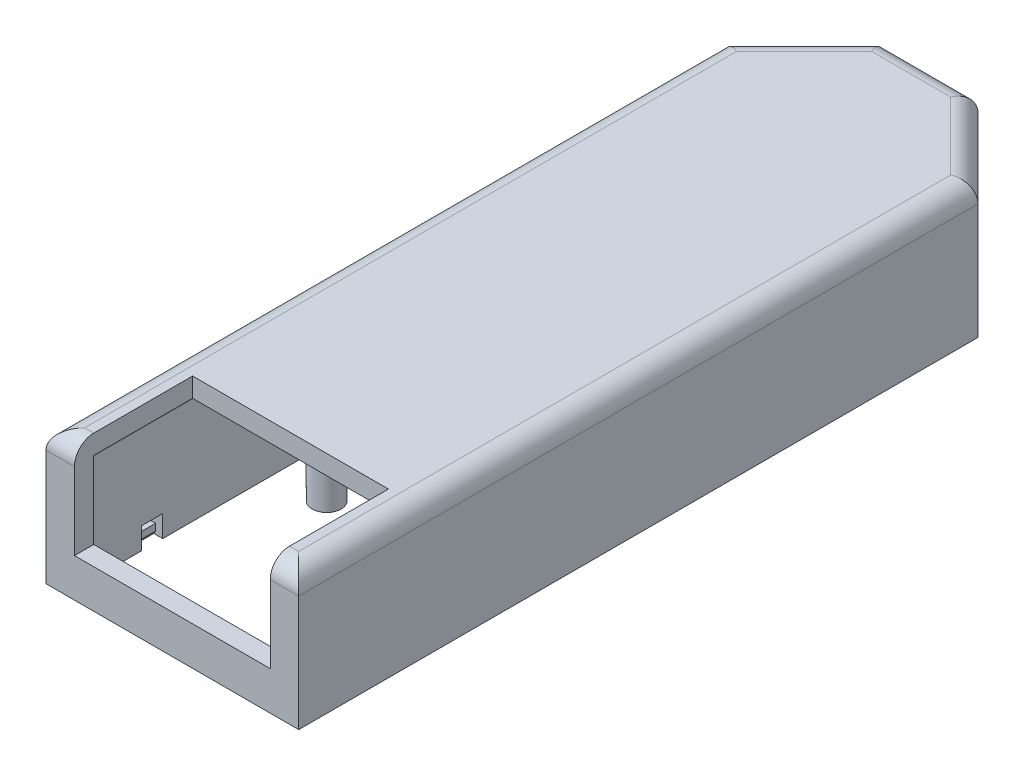
from build123d import *

# Parameters (mm, degrees)
BOSS_EXTRUDE1_DEPTH       = 14
CUT_EXTRUDE1_DEPTH        = 12
SKETCH3_W                 = 1.75
SKETCH3_H                 = 2.2
CUT_EXTRUDE2_DEPTH        = 2.25
SKETCH5_W                 = 2.2
SKETCH5_H                 = 1.25
CUT_EXTRUDE3_DEPTH        = 0.8
CHAMFER1_SIZE             = 0.3
CHAMFER1_SIZE2            = 0.173205081
CHAMFER1_OF_MIRROR1_SIZE2 = 0.3
CHAMFER1_OF_MIRROR1_SIZE  = 0.173205081
LPATTERN1_START           = -36.6
LPATTERN1_DEPTH           = 2.2
LPATTERN1_START_2         = -8.1
LPATTERN1_2_DEPTH         = 2.2
SKETCH7_W                 = 3
SKETCH7_H                 = 1.75
CUT_EXTRUDE4_DEPTH        = 2.25
CHAMFER2_SIZE             = 0.3
CHAMFER2_SIZE2            = 0.519615242
SKETCH8_W                 = 3
SKETCH8_H                 = 1.25
CUT_EXTRUDE5_DEPTH        = 0.85
CHAMFER2_OF_MIRROR2_SIZE2 = 0.519615242
CHAMFER2_OF_MIRROR2_SIZE  = 0.3
SKETCH9_W                 = 13
SKETCH9_H                 = 2
BOSS_EXTRUDE2_DEPTH       = 6
CUT_EXTRUDE9_REACH        = 54.413
SKETCH10_R                = 5.25
SKETCH11_R                = 1.5
BOSS_EXTRUDE3_DEPTH       = 14
CUT_EXTRUDE10_DEPTH       = 10
FILLET1_R                 = 2
FILLET2_R                 = 1
FILLET3_R                 = 2


# Read off the part's stored shape, not the designer's step: LPattern1
with BuildPart() as part:
    # Sketch1 → Boss-Extrude1 (new body)
    with BuildSketch(Plane(origin=(0, 3.6, 0), x_dir=(1, 0, 0), z_dir=(0, 1, 0))):
        Polygon((-13.1, -2), (-13.1, 68.428427125), (-4.928427125, 76.6), (4.928427125, 76.6), (13.1, 68.428427125), (13.1, -2), align=None)
    extrude(amount=BOSS_EXTRUDE1_DEPTH)

    # Sketch2 → Cut-Extrude1 (cut)
    with BuildSketch(Plane.XZ.offset(-3.6)):
        Polygon((11.1, -67.6), (4.1, -74.6), (-4.1, -74.6), (-11.1, -67.6), (-11.1, 0), (11.1, 0), align=None)
    extrude(amount=-CUT_EXTRUDE1_DEPTH, mode=Mode.SUBTRACT)

    # Sketch3 → Cut-Extrude2 (cut)
    with BuildSketch(Plane.XZ.offset(-3.6)):
        with Locations((10.975, -64)):
            Rectangle(SKETCH3_W, SKETCH3_H)
    cut_extrude2 = extrude(amount=-CUT_EXTRUDE2_DEPTH, mode=Mode.SUBTRACT)

    # Sketch5 → Cut-Extrude3 (cut)
    with BuildSketch(Plane.ZY.offset(-11.85)):
        with Locations((-64, 5.225)):
            Rectangle(SKETCH5_W, SKETCH5_H)
    cut_extrude3 = extrude(amount=-CUT_EXTRUDE3_DEPTH, mode=Mode.SUBTRACT)

    # Chamfer1
    chamfer1_edges = [part.edges().sort_by_distance(p)[0] for p in [
        (11.85, 3.6, -64),
    ]]
    chamfer1_side = [part.faces().sort_by_distance(p)[0] for p in [
        (11.85, 4.1, -64),
    ]]
    chamfer(chamfer1_edges, length=CHAMFER1_SIZE, length2=CHAMFER1_SIZE2, reference=chamfer1_side[0])

    # Mirror1: Cut-Extrude2, Cut-Extrude3 across plane
    add(cut_extrude2.mirror(Plane(origin=(0, 0, 0), x_dir=(0, 0, 1), z_dir=(1, 0, 0))), mode=Mode.SUBTRACT)
    add(cut_extrude3.mirror(Plane(origin=(0, 0, 0), x_dir=(0, 0, 1), z_dir=(1, 0, 0))), mode=Mode.SUBTRACT)

    # Chamfer1 of Mirror1
    chamfer1_of_mirror1_edges = [part.edges().sort_by_distance(p)[0] for p in [
        (-11.85, 3.6, -64),
    ]]
    chamfer(chamfer1_of_mirror1_edges, length=CHAMFER1_OF_MIRROR1_SIZE, length2=CHAMFER1_OF_MIRROR1_SIZE2)

    # LPattern1 outline → LPattern1 (cut)
    with BuildSketch(Plane.XY.offset(LPATTERN1_START)):
        Polygon((-12.023205081, 3.6), (-11.1, 3.6), (-11.1, 5.85), (-12.65, 5.85), (-12.65, 4.6), (-11.85, 4.6), (-11.85, 3.9), align=None)
        Polygon((11.85, 3.9), (11.85, 4.6), (12.65, 4.6), (12.65, 5.85), (11.1, 5.85), (11.1, 3.6), (12.023205081, 3.6), align=None)
    extrude(amount=LPATTERN1_DEPTH, mode=Mode.SUBTRACT)

    # LPattern1 2 outline → LPattern1 2 (cut)
    with BuildSketch(Plane.XY.offset(LPATTERN1_START_2)):
        Polygon((-12.023205081, 3.6), (-11.1, 3.6), (-11.1, 5.85), (-12.65, 5.85), (-12.65, 4.6), (-11.85, 4.6), (-11.85, 3.9), align=None)
        Polygon((11.85, 3.9), (11.85, 4.6), (12.65, 4.6), (12.65, 5.85), (11.1, 5.85), (11.1, 3.6), (12.023205081, 3.6), align=None)
    extrude(amount=LPATTERN1_2_DEPTH, mode=Mode.SUBTRACT)

    # Sketch7 → Cut-Extrude4 (cut)
    with BuildSketch(Plane.XZ.offset(-3.6)):
        with Locations((0, -74.475)):
            Rectangle(SKETCH7_W, SKETCH7_H)
    cut_extrude4 = extrude(amount=-CUT_EXTRUDE4_DEPTH, mode=Mode.SUBTRACT)

    # Chamfer2
    chamfer2_edges = [part.edges().sort_by_distance(p)[0] for p in [
        (0, 3.6, -75.35),
    ]]
    chamfer2_side = [part.faces().sort_by_distance(p)[0] for p in [
        (-12.271483253, 3.6, -33.214213562),
    ]]
    chamfer(chamfer2_edges, length=CHAMFER2_SIZE, length2=CHAMFER2_SIZE2, reference=chamfer2_side[0])

    # Sketch8 → Cut-Extrude5 (cut)
    with BuildSketch(Plane.XY.offset(-75.35)):
        with Locations((0, 5.225)):
            Rectangle(SKETCH8_W, SKETCH8_H)
    cut_extrude5 = extrude(amount=-CUT_EXTRUDE5_DEPTH, mode=Mode.SUBTRACT)

    # Mirror2: Cut-Extrude4, Cut-Extrude5 across plane
    add(cut_extrude4.mirror(Plane.XY.offset(-37.3)), mode=Mode.SUBTRACT)
    add(cut_extrude5.mirror(Plane.XY.offset(-37.3)), mode=Mode.SUBTRACT)

    # Chamfer2 of Mirror2
    chamfer2_of_mirror2_edges = [part.edges().sort_by_distance(p)[0] for p in [
        (0, 3.6, 0.75),
    ]]
    chamfer(chamfer2_of_mirror2_edges, length=CHAMFER2_OF_MIRROR2_SIZE, length2=CHAMFER2_OF_MIRROR2_SIZE2)

    # Sketch9 → Boss-Extrude2 (add)
    with BuildSketch(Plane.XZ.offset(-15.6)):
        with Locations((4.6, -50)):
            Rectangle(SKETCH9_W, SKETCH9_H)
        with Locations((4.6, -30)):
            Rectangle(SKETCH9_W, SKETCH9_H)
    extrude(amount=BOSS_EXTRUDE2_DEPTH)

    # Cut-Extrude9: up to this face of the body (flat: up to its plane)
    cut_extrude9_end = Plane(part.part.faces().sort_by_distance((4.6, 12.6, -51))[0])
    # Sketch10 → Cut-Extrude9 (cut, up to the picked face)
    with BuildSketch(Plane.XY.offset(-29), mode=Mode.PRIVATE) as cut_extrude9_sk1:
        with Locations((4.5, 9.6)):
            Circle(SKETCH10_R)
    cut_extrude9_tool1 = split(extrude(cut_extrude9_sk1.sketch, amount=-CUT_EXTRUDE9_REACH, mode=Mode.PRIVATE), bisect_by=cut_extrude9_end, keep=Keep.BOTH, mode=Mode.PRIVATE)
    add(cut_extrude9_tool1.solids().sort_by(Axis((4.5, 9.6, -29), (0, 0, -1)))[0], mode=Mode.SUBTRACT)

    # Sketch11 → Boss-Extrude3 (add)
    with BuildSketch(Plane(origin=(0, 17.6, 0), x_dir=(1, 0, 0), z_dir=(0, 1, 0))):
        with Locations(Location((-6, 20, 0), (0, 0, 270))):
            Circle(SKETCH11_R)
        with Locations(Location((-5, 58, 0), (0, 0, 270))):
            Circle(SKETCH11_R)
    extrude(amount=-BOSS_EXTRUDE3_DEPTH)

    # Sketch12 → Cut-Extrude10 (cut)
    with BuildSketch(Plane(origin=(0, 17.6, 0), x_dir=(1, 0, 0), z_dir=(0, 1, 0))):
        Polygon((-10.15, 1.25), (-10.15, -2), (10.15, -2), (10.15, 1.25), (10.15, 10.25), (-10.15, 10.25), align=None)
    extrude(amount=-CUT_EXTRUDE10_DEPTH, mode=Mode.SUBTRACT)

    # Fillet1
    fillet1_edges = [part.edges().sort_by_distance(p)[0] for p in [
        (9.014213562, 17.6, -72.514213562),
        (0, 17.6, -76.6),
        (-9.014213562, 17.6, -72.514213562),
        (-13.1, 17.6, -33.214213562),
        (-11.625, 17.6, 2),
        (11.625, 17.6, 2),
        (13.1, 17.6, -33.214213562),
    ]]
    fillet(fillet1_edges, radius=FILLET1_R)

    # Fillet2
    fillet2_edges = [part.edges().sort_by_distance(p)[0] for p in [
        (11.1, 15.6, -59.3),
        (11.1, 15.6, -14.5),
        (7.6, 15.6, -71.1),
        (11.1, 15.6, -40),
        (-7.6, 15.6, -71.1),
        (-11.1, 15.6, -33.8),
        (0, 15.6, -74.6),
    ]]
    fillet(fillet2_edges, radius=FILLET2_R)

    # Fillet3
    fillet3_edges = [part.edges().sort_by_distance(p)[0] for p in [
        (-6, 15.6, -21.5),
        (-5, 15.6, -59.5),
    ]]
    fillet(fillet3_edges, radius=FILLET3_R)


solid = part.part
